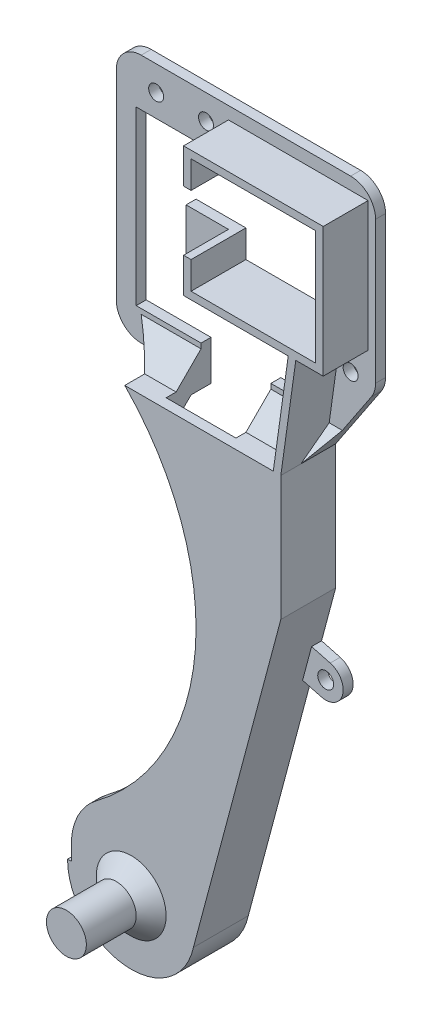
from build123d import *

# Parameters (mm, degrees)
EXTRUDE_1_DEPTH                 = 52
CUT_EXTRUDE_1_REACH             = 161.013
CUT_EXTRUDE_1_DIRECTION_2_DEPTH = 7
SKETCH_3_R                      = 1.5
CUT_EXTRUDE_2_DEPTH             = 160.138304628
SKETCH_5_R                      = 4
EXTRUDE_3_DEPTH                 = 15
FILLET_1_R                      = 5
CHAMFER_1_SIZE                  = 5
FILLET_2_R                      = 12.5
EXTRUDE_2_DEPTH                 = 9
CHAMFER_2_SIZE                  = 5
EXTRUDE_4_DEPTH                 = 9
EXTRUDE_4_DEPTH_BACK            = 2
CHAMFER_3_SIZE                  = 3
SKETCH_7_R                      = 1.6
EXTRUDE_5_DEPTH                 = 2


with BuildPart() as part:
    # 草图1 → 凸台-拉伸1 (new body)
    with BuildSketch(Plane(origin=(0, 0, 0), x_dir=(0, 0, -1), z_dir=(1, 0, 0))):
        Polygon((0, 0), (0, 98), (9, 98), (9, 150), (7, 150), (7, 100), (-2, 100), (-2, 0), align=None)
    extrude(amount=EXTRUDE_1_DEPTH)

    # 草图2 → 切除-拉伸1 (cut, up to next)
    with BuildSketch(Plane.XY.offset(-7), mode=Mode.PRIVATE) as cut_extrude_1_sk1:
        Polygon((24, 146), (49, 146), (49, 123), (24, 123), (24, 128.5), (14, 128.5), (14, 117), (41, 117), (41, 106), (31, 106), (31, 98), (17, 98), (17, 106), (4, 106), (4, 140.5), (24, 140.5), align=None)
    cut_extrude_1_tool1 = extrude(cut_extrude_1_sk1.sketch, amount=-CUT_EXTRUDE_1_REACH, mode=Mode.PRIVATE) & part.part
    add(cut_extrude_1_tool1.solids().sort_by_distance((25.692202, 124.595066, -7))[0], mode=Mode.SUBTRACT)

    # 草图2 → 切除-拉伸1 direction 2 (cut)
    with BuildSketch(Plane.XY.offset(-7)):
        Polygon((24, 146), (49, 146), (49, 123), (24, 123), (24, 128.5), (14, 128.5), (14, 117), (41, 117), (41, 106), (31, 106), (31, 98), (17, 98), (17, 106), (4, 106), (4, 140.5), (24, 140.5), align=None)
    extrude(amount=CUT_EXTRUDE_1_DIRECTION_2_DEPTH, mode=Mode.SUBTRACT)

    # 草图3 → 切除-拉伸2 (cut, through all)
    with BuildSketch(Plane.XY.offset(2)):
        with Locations((8, 145)):
            Circle(SKETCH_3_R)
        with Locations((18, 145)):
            Circle(SKETCH_3_R)
        with Locations((47, 116)):
            Circle(SKETCH_3_R)
        with BuildLine():
            Line((0, 100), (10.707142143, 100))
            ThreePointArc((10.707142143, 100), (24.538989746, 58.225895269), (0, 21.698729811))
            Line((0, 21.698729811), (0, 100))
        make_face()
        Polygon((42, 75), (42, 100), (52, 115), (52, 0), (22, 0), align=None)
    extrude(amount=-CUT_EXTRUDE_2_DEPTH, mode=Mode.SUBTRACT)

    # 草图5 → 凸台-拉伸3 (add)
    with BuildSketch(Plane(origin=(0, 0, 0), x_dir=(-1, 0, 0), z_dir=(0, 0, -1))):
        with Locations(Location((-12, 12, 0), (0, 0, 90))):
            Circle(SKETCH_5_R)
    extrude(amount=-EXTRUDE_3_DEPTH)

    # 圆角1
    fillet_1_edges = [part.edges().sort_by_distance(p)[0] for p in [
        (52, 115, -8),
        (0, 100, -8),
        (52, 150, -8),
        (0, 150, -8),
    ]]
    fillet(fillet_1_edges, radius=FILLET_1_R)

    # 倒角1
    chamfer_1_edges = [part.edges().sort_by_distance(p)[0] for p in [
        (13.853571071, 100, -7),
        (36.5, 100, -7),
    ]]
    chamfer(chamfer_1_edges, length=CHAMFER_1_SIZE)

    # 圆角2
    # the kernel refuses this fillet: 12.5 mm, written as the material it takes off along each edge
    with BuildSketch(Plane(origin=(0, 0, 33.25), x_dir=(1, 0, 0), z_dir=(0, 0, -1))) as fillet_2_piece_1:
        with BuildLine():
            CenterArc((FILLET_2_R, -FILLET_2_R), FILLET_2_R, 90, 90)
            Line((0, -FILLET_2_R), (0, 0))
            Line((0, 0), (FILLET_2_R, 0))
        make_face()
    extrude(amount=64.5, mode=Mode.SUBTRACT)
    with BuildSketch(Plane(origin=(22, 0, 26.008697284), x_dir=(0.2576626505603325, 0.9662349396012462, 0), z_dir=(0, 0, -1))) as fillet_2_piece_2:
        with BuildLine():
            CenterArc((FILLET_2_R * 0.768278313084, -FILLET_2_R), FILLET_2_R, 90, 75.068582822)
            Line((-FILLET_2_R * 0.197956626517, -FILLET_2_R * 0.74233734944), (0, 0))
            Line((0, 0), (FILLET_2_R * 0.768278313084, 0))
        make_face()
    extrude(amount=50.017394568, mode=Mode.SUBTRACT)
    with BuildSketch(Plane(origin=(0, 21.698729811, 18.746824527), x_dir=(0.8345119301206998, 0.550989871491504, 0), z_dir=(0, 0, -1))) as fillet_2_piece_3:
        with BuildLine():
            CenterArc((6.740466849, 12.477543337), FILLET_2_R, 213.434948823, 53.130102354)
            Line((-3.690932278, 5.590169944), (0, 0))
            ThreePointArc((0, 0), (2.995763044, 0.08982665), (5.991526088, 0))
        make_face()
    extrude(amount=35.493649054, mode=Mode.SUBTRACT)

    # 草图4 → 凸台-拉伸2 (add)
    with BuildSketch(Plane.XY.offset(-7)):
        Polygon((24, 128.5), (24, 123), (49, 123), (49, 146), (24, 146), (24, 140.5), (22.5, 140.5), (22.5, 147.5), (50.5, 147.5), (50.5, 121.5), (45, 121.5), (42, 100), (40.485467906, 100), (43.485467906, 121.5), (22.5, 121.5), (22.5, 128.5), align=None)
    extrude(amount=EXTRUDE_2_DEPTH)

    # 倒角2
    chamfer_2_edges = [part.edges().sort_by_distance(p)[0] for p in [
        (14.781639971, 98, 0),
        (36.5, 98, 0),
    ]]
    chamfer(chamfer_2_edges, length=CHAMFER_2_SIZE)

    # 草图6 → 凸台-拉伸4 (add, two sides: drawn at the far end of the back side and taken through both)
    with BuildSketch(Plane(origin=(0, 0, 0), x_dir=(-1, 0, 0), z_dir=(0, 0, -1)).offset(-EXTRUDE_4_DEPTH_BACK)):
        with BuildLine():
            Line((-40.5, 100), (-42, 100))
            Line((-42, 100), (-42, 75))
            Line((-42, 75), (-24.474457831, 9.279216868))
            ThreePointArc((-24.474457831, 9.279216868), (-10.631728691, -0.694195235), (0.76772333, 12))
            Line((0.76772333, 12), (-0.727521137, 12))
            ThreePointArc((-0.727521137, 12), (-10.853296347, 0.785997572), (-23.03917982, 9.718489836))
            Line((-23.03917982, 9.718489836), (-40.5, 75.196565511))
            Line((-40.5, 75.196565511), (-40.5, 100))
        make_face()
    extrude(amount=EXTRUDE_4_DEPTH + EXTRUDE_4_DEPTH_BACK)

    # 倒角3
    chamfer_3_edges = [part.edges().sort_by_distance(p)[0] for p in [
        (12, 8, 2),
    ]]
    chamfer(chamfer_3_edges, length=CHAMFER_3_SIZE)

    # 草图7 → 凸台-拉伸5 (add)
    with BuildSketch(Plane(origin=(0, 0, -9), x_dir=(-1, 0, 0), z_dir=(0, 0, -1))):
        with BuildLine():
            Line((-39.167379443, 64.377672911), (-42.901819277, 63.381822289))
            ThreePointArc((-42.901819277, 63.381822289), (-45.381822289, 59.098180723), (-41.098180723, 56.618177711))
            Line((-41.098180723, 56.618177711), (-37.363740889, 57.614028334))
            Line((-37.363740889, 57.614028334), (-39.167379443, 64.377672911))
        make_face()
        with Locations(Location((-42, 60, 0), (0, 0, 90))):
            Circle(SKETCH_7_R, mode=Mode.SUBTRACT)
    extrude(amount=-EXTRUDE_5_DEPTH)


solid = part.part
